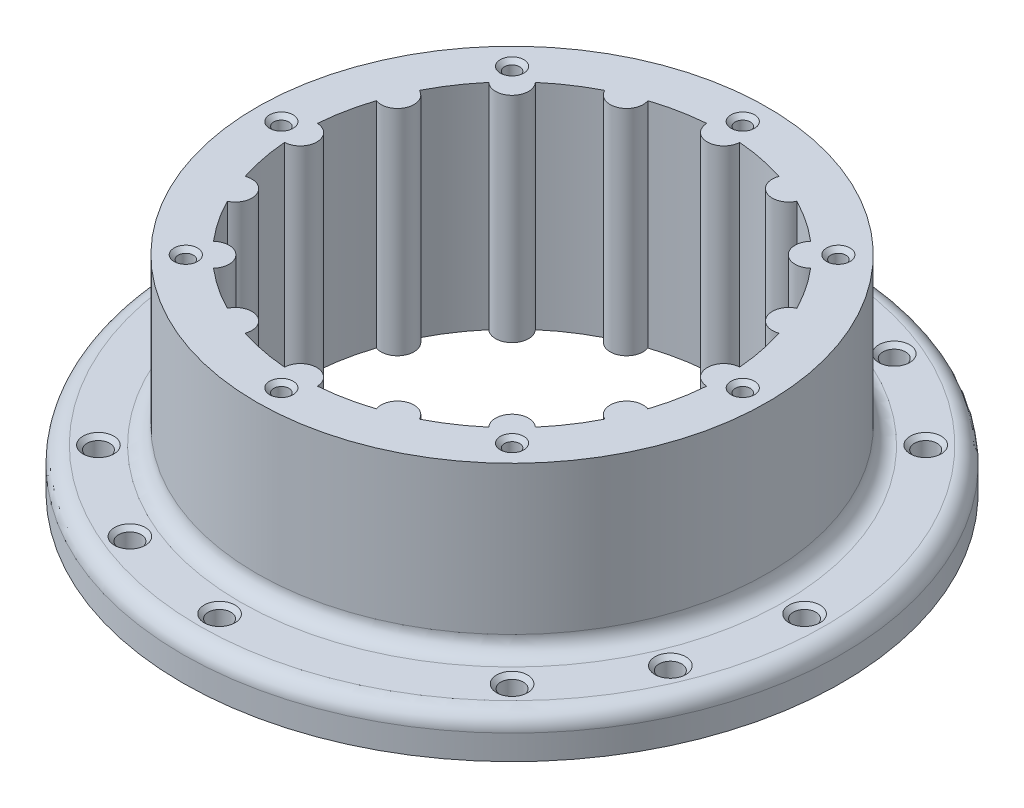
from build123d import *

# Parameters (mm, degrees)
SKETCH1_R                       = 80
SKETCH1_R_2                     = 62
BOSS_EXTRUDE1_DEPTH             = 10
BOSS_EXTRUDE2_DEPTH             = 40
BOSS_EXTRUDE2_DEPTH_BACK        = 12
SKETCH4_R                       = 62
SKETCH4_R_2                     = 51.4
BOSS_EXTRUDE3_REACH             = 122
BOSS_EXTRUDE3_DIRECTION_2_REACH = 122
CIRPATTERN1_COUNT               = 16
SKETCH8_R                       = 2.75
CUT_EXTRUDE4_DEPTH              = 121
CHAMFER1_SIZE                   = 1
CIRPATTERN2_COUNT               = 8
CHAMFER1_OF_CIRPATTERN2_SIZE    = 1
CHAMFER2_SIZE                   = 0.5
SKETCH9_R                       = 1.85
CUT_EXTRUDE5_DEPTH              = 15
CHAMFER3_SIZE                   = 1
SKETCH10_R                      = 2.75
CUT_EXTRUDE6_DEPTH              = 121
CHAMFER4_SIZE                   = 1
CIRPATTERN4_COUNT               = 4
CHAMFER4_OF_CIRPATTERN4_SIZE    = 1
CIRPATTERN3_COUNT               = 8
CHAMFER3_OF_CIRPATTERN3_SIZE    = 1
FILLET1_R                       = 4
FILLET2_R                       = 4


with BuildPart() as part:
    # Sketch1 → Boss-Extrude1 (new body)
    with BuildSketch(Plane(origin=(0, 0, 0), x_dir=(1, 0, 0), z_dir=(0, 1, 0))):
        Circle(SKETCH1_R)
        Circle(SKETCH1_R_2, mode=Mode.SUBTRACT)
    extrude(amount=BOSS_EXTRUDE1_DEPTH)

    # Sketch4 → Boss-Extrude2 (add, two sides: drawn at the far end of the back side and taken through both)
    with BuildSketch(Plane(origin=(0, 10, 0), x_dir=(1, 0, 0), z_dir=(0, 1, 0)).offset(-BOSS_EXTRUDE2_DEPTH_BACK)):
        Circle(SKETCH4_R)
        Circle(SKETCH4_R_2, mode=Mode.SUBTRACT)
    extrude(amount=BOSS_EXTRUDE2_DEPTH + BOSS_EXTRUDE2_DEPTH_BACK)

    # Boss-Extrude3: up to this face of the body (flat: up to its plane)
    boss_extrude3_end = Plane(part.part.faces().sort_by_distance((-60.246375183, 50, 0))[0])
    # Sketch5 → Boss-Extrude3 (add, up to the picked face)
    with BuildSketch(Plane(origin=(0, 10, 0), x_dir=(1, 0, 0), z_dir=(0, 1, 0)), mode=Mode.PRIVATE) as boss_extrude3_sk1:
        with BuildLine():
            ThreePointArc((-51.244357977, -3.996970798), (-47.4, 0), (-51.244357977, 3.996970798))
            ThreePointArc((-51.244357977, 3.996970798), (-51.4, 0), (-51.244357977, -3.996970798))
        make_face()
    boss_extrude3_tool1 = split(extrude(boss_extrude3_sk1.sketch, amount=BOSS_EXTRUDE3_REACH, mode=Mode.PRIVATE), bisect_by=boss_extrude3_end, keep=Keep.BOTH, mode=Mode.PRIVATE)
    boss_extrude3 = boss_extrude3_tool1.solids().sort_by(Axis((-49.674621, 10, 0), (0, 1, 0)))[0]
    add(boss_extrude3)

    # Boss-Extrude3 direction 2: up to this face of the body (flat: up to its plane)
    boss_extrude3_direction_2_end = Plane(part.part.faces().sort_by_distance((-60.246375183, -2, 0))[0])
    # Sketch5 → Boss-Extrude3 direction 2 (add, up to the picked face)
    with BuildSketch(Plane(origin=(0, 10, 0), x_dir=(1, 0, 0), z_dir=(0, 1, 0)), mode=Mode.PRIVATE) as boss_extrude3_direction_2_sk1:
        with BuildLine():
            ThreePointArc((-51.244357977, -3.996970798), (-47.4, 0), (-51.244357977, 3.996970798))
            ThreePointArc((-51.244357977, 3.996970798), (-51.4, 0), (-51.244357977, -3.996970798))
        make_face()
    boss_extrude3_direction_2_tool1 = split(extrude(boss_extrude3_direction_2_sk1.sketch, amount=-BOSS_EXTRUDE3_DIRECTION_2_REACH, mode=Mode.PRIVATE), bisect_by=boss_extrude3_direction_2_end, keep=Keep.BOTH, mode=Mode.PRIVATE)
    boss_extrude3_direction_2 = boss_extrude3_direction_2_tool1.solids().sort_by(Axis((-49.674621, 10, 0), (0, -1, 0)))[0]
    add(boss_extrude3_direction_2)

    # CirPattern1: Boss-Extrude3, Boss-Extrude3 direction 2 ×16 about axis
    cirpattern1_axis = Axis((0, 50, 0), (0, 1, 0))
    add([boss_extrude3.rotate(cirpattern1_axis, i * 360 / CIRPATTERN1_COUNT) for i in range(1, CIRPATTERN1_COUNT)])
    add([boss_extrude3_direction_2.rotate(cirpattern1_axis, i * 360 / CIRPATTERN1_COUNT) for i in range(1, CIRPATTERN1_COUNT)])

    # Sketch8 → Cut-Extrude4 (cut, through all)
    with BuildSketch(Plane(origin=(0, 10, 0), x_dir=(1, 0, 0), z_dir=(0, 1, 0))):
        with Locations((0, 71)):
            Circle(SKETCH8_R)
    cut_extrude4 = extrude(amount=-CUT_EXTRUDE4_DEPTH, mode=Mode.SUBTRACT)

    # Chamfer1
    chamfer1_edges = [part.edges().sort_by_distance(p)[0] for p in [
        (-2.75, 10, -71),
    ]]
    chamfer(chamfer1_edges, length=CHAMFER1_SIZE)

    # CirPattern2: Cut-Extrude4 ×8 about axis
    cirpattern2_axis = Axis((0, 10, 0), (0, 1, 0))
    for i in range(1, CIRPATTERN2_COUNT):
        add(cut_extrude4.rotate(cirpattern2_axis, i * 360 / CIRPATTERN2_COUNT), mode=Mode.SUBTRACT)

    # Chamfer1 of CirPattern2
    chamfer1_of_cirpattern2_edges = [part.edges().sort_by_distance(p)[0] for p in [
        (-52.149125113, 10, -48.260037816),
        (-71, 10, 2.75),
        (-48.260037816, 10, 52.149125113),
        (2.75, 10, 71),
        (52.149125113, 10, 48.260037816),
        (71, 10, -2.75),
        (48.260037816, 10, -52.149125113),
    ]]
    chamfer(chamfer1_of_cirpattern2_edges, length=CHAMFER1_OF_CIRPATTERN2_SIZE)

    # Chamfer2
    chamfer2_edges = [part.edges().sort_by_distance(p)[0] for p in [
        (-62, -2, 0),
    ]]
    chamfer(chamfer2_edges, length=CHAMFER2_SIZE)

    # Sketch9 → Cut-Extrude5 (cut)
    with BuildSketch(Plane(origin=(0, 50, 0), x_dir=(1, 0, 0), z_dir=(0, 1, 0))):
        with Locations((0, 56)):
            Circle(SKETCH9_R)
    cut_extrude5 = extrude(amount=-CUT_EXTRUDE5_DEPTH, mode=Mode.SUBTRACT)

    # Chamfer3
    chamfer3_edges = [part.edges().sort_by_distance(p)[0] for p in [
        (-1.85, 50, -56),
    ]]
    chamfer(chamfer3_edges, length=CHAMFER3_SIZE)

    # Sketch10 → Cut-Extrude6 (cut, through all)
    with BuildSketch(Plane(origin=(0, 10, 0), x_dir=(1, 0, 0), z_dir=(0, 1, 0))):
        with Locations((27.170523698, 65.595446808)):
            Circle(SKETCH10_R)
    cut_extrude6 = extrude(amount=-CUT_EXTRUDE6_DEPTH, mode=Mode.SUBTRACT)

    # Chamfer4
    chamfer4_edges = [part.edges().sort_by_distance(p)[0] for p in [
        (24.420523698, 10, -65.595446808),
    ]]
    chamfer(chamfer4_edges, length=CHAMFER4_SIZE)

    # CirPattern4: Cut-Extrude6 ×4 about axis
    cirpattern4_axis = Axis((0, 10, 0), (0, 1, 0))
    for i in range(1, CIRPATTERN4_COUNT):
        add(cut_extrude6.rotate(cirpattern4_axis, i * 360 / CIRPATTERN4_COUNT), mode=Mode.SUBTRACT)

    # Chamfer4 of CirPattern4
    chamfer4_of_cirpattern4_edges = [part.edges().sort_by_distance(p)[0] for p in [
        (-65.595446808, 10, -24.420523698),
        (-24.420523698, 10, 65.595446808),
        (65.595446808, 10, 24.420523698),
    ]]
    chamfer(chamfer4_of_cirpattern4_edges, length=CHAMFER4_OF_CIRPATTERN4_SIZE)

    # CirPattern3: Cut-Extrude5 ×8 about axis
    cirpattern3_axis = Axis((0, 50, 0), (0, 1, 0))
    for i in range(1, CIRPATTERN3_COUNT):
        add(cut_extrude5.rotate(cirpattern3_axis, i * 360 / CIRPATTERN3_COUNT), mode=Mode.SUBTRACT)

    # Chamfer3 of CirPattern3
    chamfer3_of_cirpattern3_edges = [part.edges().sort_by_distance(p)[0] for p in [
        (-40.906127292, 50, -38.289832201),
        (-56, 50, 1.85),
        (-38.289832201, 50, 40.906127292),
        (1.85, 50, 56),
        (40.906127292, 50, 38.289832201),
        (56, 50, -1.85),
        (38.289832201, 50, -40.906127292),
    ]]
    chamfer(chamfer3_of_cirpattern3_edges, length=CHAMFER3_OF_CIRPATTERN3_SIZE)

    # Fillet1
    fillet1_edges = [part.edges().sort_by_distance(p)[0] for p in [
        (-62, 10, 0),
    ]]
    fillet(fillet1_edges, radius=FILLET1_R)

    # Fillet2
    fillet2_edges = [part.edges().sort_by_distance(p)[0] for p in [
        (-80, 10, 0),
    ]]
    fillet(fillet2_edges, radius=FILLET2_R)


solid = part.part
